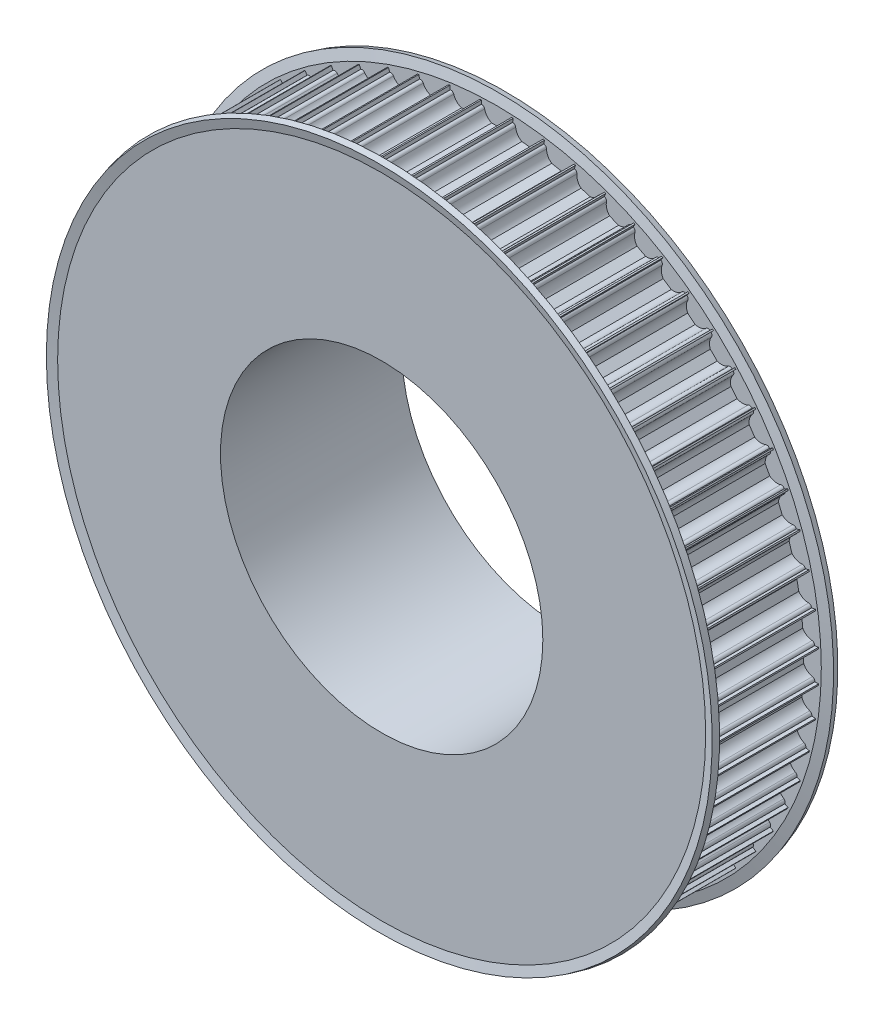
from build123d import *

# Parameters (mm, degrees)
CUT_EXTRUDE1_REACH = 123.758
CIRPATTERN1_COUNT  = 64


with BuildPart() as part:
    # Sketch1 → Revolve1 (revolve)
    with BuildSketch(Plane(origin=(0, 0, 0), x_dir=(0, 0, -1), z_dir=(1, 0, 0))):
        Polygon((0, 40), (0, 80), (30, 80), (30, 55.5), (45, 55.5), (45, 40), align=None)
    revolve(axis=Axis((0, 0, 0), (0, 0, -1)))

    # Sketch2 → Cut-Extrude1 (cut, up to next)
    with BuildSketch(Plane.XY, mode=Mode.PRIVATE) as cut_extrude1_sk1:
        with BuildLine():
            Line((-3.674234614, 79), (-3.75, 79))
            Line((-3.75, 79), (-3.75, 81))
            Line((-3.75, 81), (3.75, 81))
            Line((3.75, 81), (3.75, 79))
            Line((3.75, 79), (3.674234614, 79))
            ThreePointArc((3.674234614, 79), (3.199892965, 78.830947502), (2.939387691, 78.4))
            ThreePointArc((2.939387691, 78.4), (2.331759211, 77.112435701), (1.198957881, 76.25))
            Line((1.198957881, 76.25), (-1.198957881, 76.25))
            ThreePointArc((-1.198957881, 76.25), (-2.331759211, 77.112435701), (-2.939387691, 78.4))
            ThreePointArc((-2.939387691, 78.4), (-3.199892965, 78.830947502), (-3.674234614, 79))
        make_face()
    cut_extrude1_tool1 = extrude(cut_extrude1_sk1.sketch, amount=-CUT_EXTRUDE1_REACH, mode=Mode.PRIVATE) & part.part
    cut_extrude1 = cut_extrude1_tool1.solids().sort_by_distance((0, 78.935169, 0))[0]
    add(cut_extrude1, mode=Mode.SUBTRACT)

    # CirPattern1: Cut-Extrude1 ×64 about axis
    cirpattern1_axis = Axis((0, 0, 0), (0, 0, 1))
    for i in range(1, CIRPATTERN1_COUNT):
        add(cut_extrude1.rotate(cirpattern1_axis, i * 360 / CIRPATTERN1_COUNT), mode=Mode.SUBTRACT)

    # Sketch3 → Revolve2 (revolve)
    with BuildSketch(Plane(origin=(0, 0, 0), x_dir=(0, 0, -1), z_dir=(1, 0, 0))):
        Polygon((30, 55.5), (30, 80.412521254), (30.591966801, 82.621771432), (29.143078062, 83.01), (28.5, 80.61), (28.5, 55.5), align=None)
        Polygon((1.5, 80.61), (1.5, 55.5), (0, 55.5), (0, 80.412521254), (-0.591966801, 82.621771432), (0.856921938, 83.01), align=None)
    revolve(axis=Axis((0, 0, 0), (0, 0, 1)))


solid = part.part
